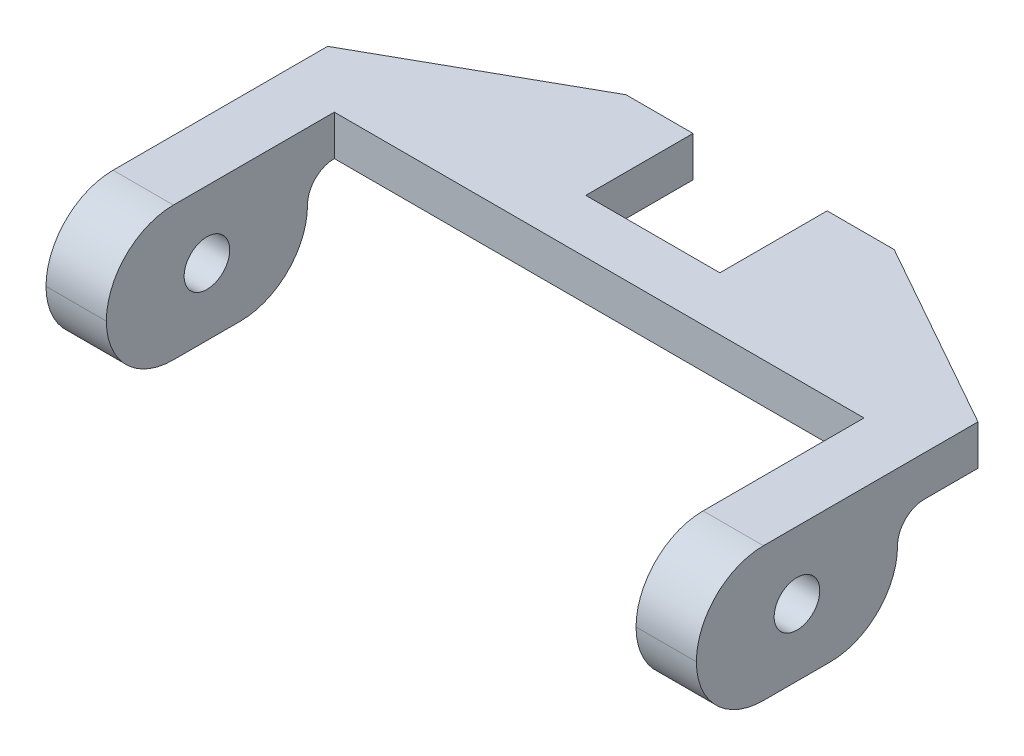
from build123d import *

# Parameters (mm, degrees)
BOSS_EXTRUDE1_DEPTH = 3
SKETCH3_W           = 4.5
SKETCH3_H           = 15
BOSS_EXTRUDE3_DEPTH = 7
CUT_EXTRUDE1_REACH  = 55.313
SKETCH4_R           = 1.7
FILLET2_R           = 5
FILLET3_R           = 2


with BuildPart() as part:
    # Sketch1 → Boss-Extrude1 (new body)
    with BuildSketch(Plane(origin=(0, 0, 0), x_dir=(1, 0, 0), z_dir=(0, 1, 0))):
        Polygon((-5, 0), (5, 0), (5, 8), (10, 8), (24.25, 0), (24.25, -21), (19.75, -21), (19.75, -4), (-19.75, -4), (-19.75, -21), (-24.25, -21), (-24.25, 0), (-10, 8), (-5, 8), align=None)
    extrude(amount=BOSS_EXTRUDE1_DEPTH)

    # Sketch3 → Boss-Extrude3 (add)
    with BuildSketch(Plane.XZ):
        with Locations((22, 13.5)):
            Rectangle(SKETCH3_W, SKETCH3_H)
    boss_extrude3 = extrude(amount=BOSS_EXTRUDE3_DEPTH)

    # Sketch4 → Cut-Extrude1 (cut, up to next)
    with BuildSketch(Plane(origin=(24.25, 0, 0), x_dir=(0, 0, -1), z_dir=(1, 0, 0)), mode=Mode.PRIVATE) as cut_extrude1_sk1:
        with Locations((-13.5, -2)):
            Circle(SKETCH4_R)
    cut_extrude1_tool1 = extrude(cut_extrude1_sk1.sketch, amount=-CUT_EXTRUDE1_REACH, mode=Mode.PRIVATE) & part.part
    cut_extrude1 = cut_extrude1_tool1.solids().sort_by_distance((24.25, -2, 13.5))[0]
    add(cut_extrude1, mode=Mode.SUBTRACT)

    # Mirror2: Boss-Extrude3, Cut-Extrude1 across plane
    add(boss_extrude3.mirror(Plane(origin=(0, 0, 0), x_dir=(0, 0, 1), z_dir=(1, 0, 0))))
    add(cut_extrude1.mirror(Plane(origin=(0, 0, 0), x_dir=(0, 0, 1), z_dir=(1, 0, 0))), mode=Mode.SUBTRACT)

    # Fillet2
    fillet2_edges = [part.edges().sort_by_distance(p)[0] for p in [
        (22, -7, 6),
        (22, -7, 21),
        (22, 3, 21),
        (-22, -7, 6),
        (-22, -7, 21),
        (-22, 3, 21),
    ]]
    fillet(fillet2_edges, radius=FILLET2_R - 0.0001)  # a hair under: the kernel refuses the full size

    # Fillet3
    fillet3_edges = [part.edges().sort_by_distance(p)[0] for p in [
        (22, 0, 6),
        (-22, 0, 6),
    ]]
    fillet(fillet3_edges, radius=FILLET3_R)


solid = part.part
